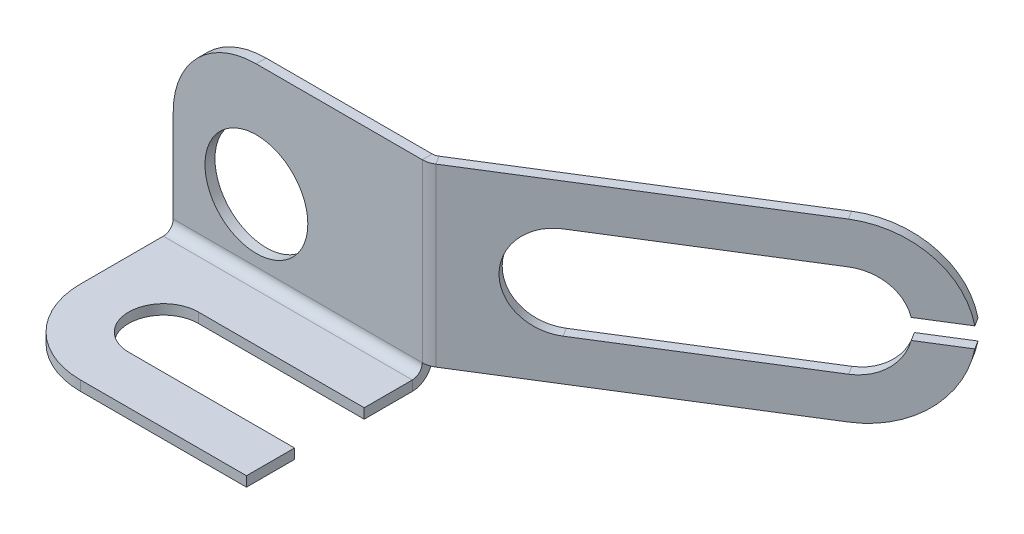
from build123d import *

# Parameters (mm, degrees)
BASE_FLANGE1_DEPTH = 0.6
CUT_EXTRUDE1_DEPTH = 10
EDGE_FLANGE1_DEPTH = 15.014611851
CUT_EXTRUDE2_DEPTH = 10
SKETCH11_R         = 3.1
CUT_EXTRUDE3_DEPTH = 10
EDGE_FLANGE2_DEPTH = 10.6
CUT_EXTRUDE4_DEPTH = 10
CUT_EXTRUDE5_DEPTH = 10


# Sheet-metal steps are written as plain solids
with BuildPart() as part:
    # Sketch1 → Base-Flange1 (new body)
    with BuildSketch(Plane(origin=(0, 0, 0), x_dir=(1, 0, 0), z_dir=(0, 1, 0))):
        with BuildLine():
            Line((-8.474188988, 5), (6.540422863, 5))
            Line((6.540422863, 5), (6.540422863, -5))
            Line((6.540422863, -5), (-3.474188988, -5))
            ThreePointArc((-3.474188988, -5), (-7.009722894, -3.535533906), (-8.474188988, 0))
            Line((-8.474188988, 0), (-8.474188988, 5))
        make_face()
    extrude(amount=-BASE_FLANGE1_DEPTH)

    # Sketch6 → Cut-Extrude1 (cut)
    with BuildSketch(Plane(origin=(0, 0, 0), x_dir=(1, 0, 0), z_dir=(0, 1, 0))):
        with BuildLine():
            Line((6.540422863, -2.1), (-3.459577137, -2.1))
            ThreePointArc((-3.459577137, -2.1), (-5.559577137, 0), (-3.459577137, 2.1))
            Line((-3.459577137, 2.1), (6.540422863, 2.1))
            Line((6.540422863, 2.1), (6.540422863, -2.1))
        make_face()
    extrude(amount=-CUT_EXTRUDE1_DEPTH, mode=Mode.SUBTRACT)

    # Edge-Flange1 section (across the edge) → Edge-Flange1 (add)
    with BuildSketch(Plane(origin=(6.540422863, 0, -5.6), x_dir=(0, 0, 1), z_dir=(-1, 0, 0))):
        with BuildLine():
            Line((-0.6, 0.6), (-0.6, 11.2))
            Line((-0.6, 11.2), (0, 11.2))
            Line((0, 11.2), (0, 0.6))
            ThreePointArc((0, 0.6), (0.175735931, 0.175735931), (0.6, 0))
            Line((0.6, 0), (0.6, -0.6))
            ThreePointArc((0.6, -0.6), (-0.248528137, -0.248528137), (-0.6, 0.6))
        make_face()
    extrude(amount=EDGE_FLANGE1_DEPTH)

    # Sketch10 → Cut-Extrude2 (cut)
    with BuildSketch(Plane.XY.offset(-5.6)):
        with BuildLine():
            Line((-8.474188988, 6.2), (-8.474188988, 11.2))
            Line((-8.474188988, 11.2), (-3.474188988, 11.2))
            ThreePointArc((-3.474188988, 11.2), (-7.009722894, 9.735533906), (-8.474188988, 6.2))
        make_face()
    extrude(amount=-CUT_EXTRUDE2_DEPTH, mode=Mode.SUBTRACT)

    # Sketch11 → Cut-Extrude3 (cut)
    with BuildSketch(Plane.XY.offset(-5.6)):
        with Locations((-3.459577137, 4.4)):
            Circle(SKETCH11_R)
    extrude(amount=-CUT_EXTRUDE3_DEPTH, mode=Mode.SUBTRACT)

    # Edge-Flange2 section (across the edge) → Edge-Flange2 (add)
    with BuildSketch(Plane(origin=(6.712470095, 11.2, -6.2), x_dir=(-0.5299192642332, 0, -0.8480480961564292), z_dir=(0, -1, 0))):
        with BuildLine():
            Line((-0.6, 0.172047231), (-0.6, 23.827952769))
            Line((-0.6, 23.827952769), (0, 23.827952769))
            Line((0, 23.827952769), (0, 0.172047231))
            ThreePointArc((0, 0.172047231), (0.023242982, 0.006664818), (0.091171142, -0.145904327))
            Line((0.091171142, -0.145904327), (-0.417657715, -0.463855886))
            ThreePointArc((-0.417657715, -0.463855886), (-0.553514035, -0.158717596), (-0.6, 0.172047231))
        make_face()
    extrude(amount=EDGE_FLANGE2_DEPTH)

    # Sketch17 → Cut-Extrude4 (cut)
    with BuildSketch(Plane(origin=(-0.583351544, 0, -0.933557619), x_dir=(0.848048096156429, 0, -0.5299192642332), z_dir=(0.5299192642332001, 0, 0.8480480961564291))):
        with BuildLine():
            Line((14.714141037, 8.7), (27.214141037, 8.7))
            ThreePointArc((27.214141037, 8.7), (30.014141037, 5.9), (27.214141037, 3.1))
            Line((27.214141037, 3.1), (14.714141037, 3.1))
            ThreePointArc((14.714141037, 3.1), (11.914141037, 5.9), (14.714141037, 8.7))
        make_face()
        with BuildLine():
            Line((32.805949691, 11.2), (32.805949691, 0.6))
            Line((32.805949691, 0.6), (27.205949691, 0.6))
            ThreePointArc((27.205949691, 0.6), (31.058221748, 2.135519713), (32.797908203, 5.9))
            ThreePointArc((32.797908203, 5.9), (31.058221748, 9.664480287), (27.205949691, 11.2))
            Line((27.205949691, 11.2), (32.805949691, 11.2))
        make_face()
    extrude(amount=-CUT_EXTRUDE4_DEPTH, mode=Mode.SUBTRACT)

    # Sketch19 → Cut-Extrude5 (cut)
    with BuildSketch(Plane(origin=(-0.583351544, 0, -0.933557619), x_dir=(0.8480480961564292, 0, -0.5299192642331998), z_dir=(0.5299192642331998, 0, 0.8480480961564292))):
        with BuildLine():
            Line((32.733155133, 5.3), (29.949099903, 5.3))
            ThreePointArc((29.949099903, 5.3), (30.014141037, 5.9), (29.949099903, 6.5))
            Line((29.949099903, 6.5), (32.733155133, 6.5))
            ThreePointArc((32.733155133, 6.5), (32.809148381, 5.9), (32.733155133, 5.3))
        make_face()
    extrude(amount=-CUT_EXTRUDE5_DEPTH, mode=Mode.SUBTRACT)


solid = part.part
